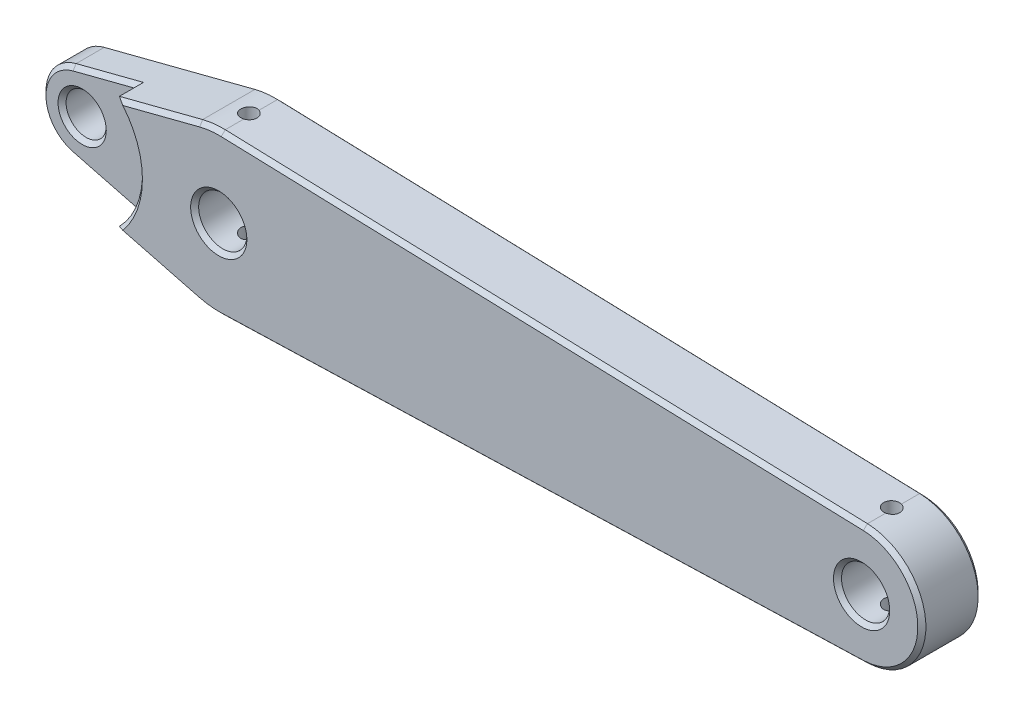
from build123d import *

# Parameters (mm, degrees)
SKETCH_1_R          = 2.5
SKETCH_1_R_2        = 3
EXTRUDE_1_DEPTH     = 3.75
SKETCH_2_R          = 1
CUT_EXTRUDE_1_DEPTH = 20
SKETCH_3_R          = 10
CUT_EXTRUDE_2_DEPTH = 3
CHAMFER_1_SIZE      = 0.5


with BuildPart() as part:
    # 草图1 → 凸台-拉伸1 (new, symmetric)
    with BuildSketch(Plane.XY):
        with BuildLine():
            Line((-21.25, 4.841229183), (-2.5, 9.682458366))
            ThreePointArc((-2.5, 9.682458366), (-1.104865494, 9.938776194), (0.3125, 9.995115995))
            Line((0.3125, 9.995115995), (80.234375, 7.496336996))
            ThreePointArc((80.234375, 7.496336996), (87.5, 0), (80.234375, -7.496336996))
            Line((80.234375, -7.496336996), (0.3125, -9.995115995))
            ThreePointArc((0.3125, -9.995115995), (-1.104865494, -9.938776194), (-2.5, -9.682458366))
            Line((-2.5, -9.682458366), (-21.25, -4.841229183))
            ThreePointArc((-21.25, -4.841229183), (-25, 0), (-21.25, 4.841229183))
        make_face()
        with Locations((-20, 0)):
            Circle(SKETCH_1_R, mode=Mode.SUBTRACT)
        Circle(SKETCH_1_R_2, mode=Mode.SUBTRACT)
        with Locations((80, 0)):
            Circle(SKETCH_1_R_2, mode=Mode.SUBTRACT)
    extrude(amount=EXTRUDE_1_DEPTH, both=True)

    # 草图2 → 切除-拉伸1 (cut, symmetric)
    with BuildSketch(Plane(origin=(0, 0, 0), x_dir=(1, 0, 0), z_dir=(0, 1, 0))):
        Circle(SKETCH_2_R)
        with Locations((80, 0)):
            Circle(SKETCH_2_R)
    extrude(amount=CUT_EXTRUDE_1_DEPTH, both=True, mode=Mode.SUBTRACT)

    # 草图3 → 切除-拉伸2 (cut)
    with BuildSketch(Plane.XY.offset(3.75)):
        with Locations((-20, 0)):
            Circle(SKETCH_3_R)
    extrude(amount=-CUT_EXTRUDE_2_DEPTH, mode=Mode.SUBTRACT)

    # 倒角1
    chamfer_1_edges = [part.edges().sort_by_distance(p)[0] for p in [
        (77, 0, -3.75),
        (-3, 0, -3.75),
        (-22.5, 0, -3.75),
        (-11.875, 7.261843774, -3.75),
        (-25, 0, -3.75),
        (-11.875, -7.261843774, -3.75),
        (-1.104865494, -9.938776194, -3.75),
        (40.2734375, -8.745726495, -3.75),
        (87.5, 0, -3.75),
        (40.2734375, 8.745726495, -3.75),
        (-1.104865494, 9.938776194, -3.75),
        (77, 0, 3.75),
        (-3, 0, 3.75),
        (-7.682372542, 8.344375529, 3.75),
        (-1.104865494, 9.938776194, 3.75),
        (40.2734375, 8.745726495, 3.75),
        (87.5, 0, 3.75),
        (40.2734375, -8.745726495, 3.75),
        (-1.104865494, -9.938776194, 3.75),
        (-7.682372542, -8.344375529, 3.75),
        (-10, 0, 3.75),
        (-17.057372542, 5.923760937, 0.75),
        (-25, 0, 0.75),
        (-17.057372542, -5.923760937, 0.75),
        (-22.5, 0, 0.75),
    ]]
    chamfer(chamfer_1_edges, length=CHAMFER_1_SIZE)


solid = part.part
